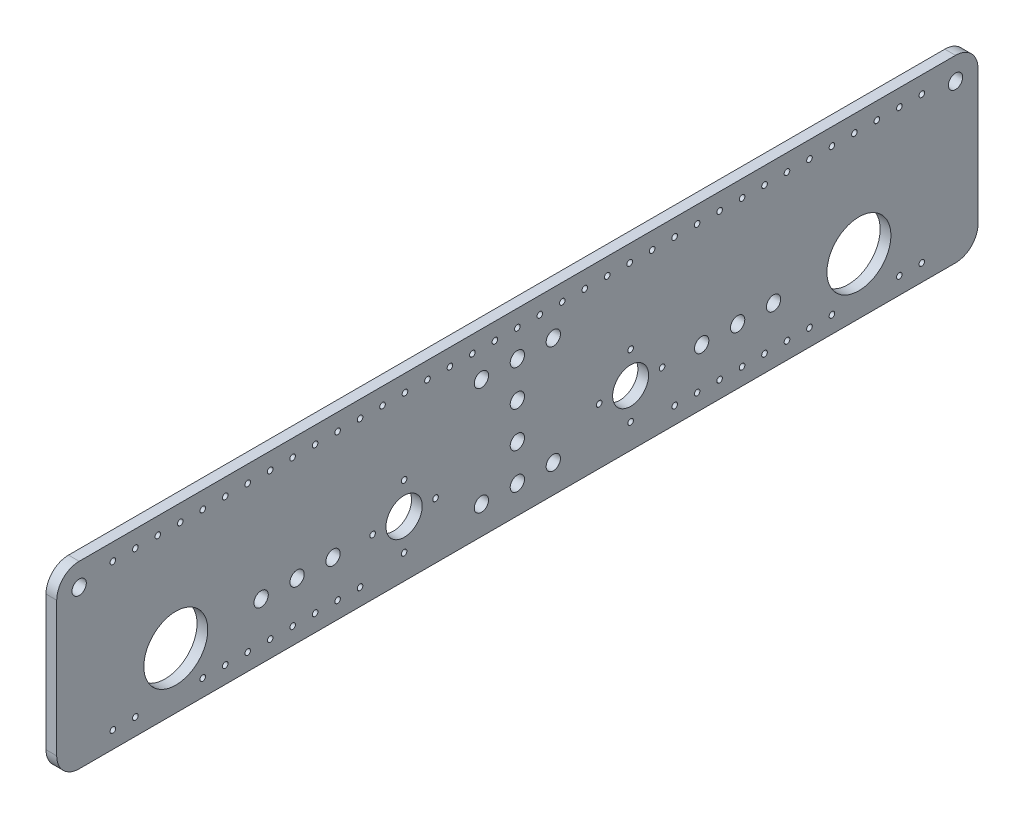
from build123d import *

# Parameters (mm, degrees)
SKETCH2_R           = 14.225
SKETCH2_R_2         = 3.18
SKETCH2_R_3         = 1.25
SKETCH2_R_4         = 8
SKETCH2_R_5         = 8.068284678
BOSS_EXTRUDE1_DEPTH = 4.7625


with BuildPart() as part:
    # Sketch2 → Boss-Extrude1 (new body)
    with BuildSketch(Plane(origin=(0, 0, 0), x_dir=(0, 0, -1), z_dir=(1, 0, 0))):
        with BuildLine():
            Line((-23.472321429, 28.668303571), (-23.472321429, -31.331696429))
            ThreePointArc((-23.472321429, -31.331696429), (-20.54338924, -38.40276424), (-13.472321429, -41.331696429))
            Line((-13.472321429, -41.331696429), (376.527678571, -41.331696429))
            ThreePointArc((376.527678571, -41.331696429), (383.598746383, -38.40276424), (386.527678571, -31.331696429))
            Line((386.527678571, -31.331696429), (386.527678571, 28.668303571))
            ThreePointArc((386.527678571, 28.668303571), (383.598746383, 35.739371383), (376.527678571, 38.668303571))
            Line((376.527678571, 38.668303571), (-13.472321429, 38.668303571))
            ThreePointArc((-13.472321429, 38.668303571), (-20.54338924, 35.739371383), (-23.472321429, 28.668303571))
        make_face()
        with Locations((29.527678571, -16.331696429)):
            Circle(SKETCH2_R, mode=Mode.SUBTRACT)
        with Locations((333.527678571, -16.331696429)):
            Circle(SKETCH2_R, mode=Mode.SUBTRACT)
        with Locations((181.527678571, -28.771696429)):
            Circle(SKETCH2_R_2, mode=Mode.SUBTRACT)
        with Locations((197.527678571, -28.771696429)):
            Circle(SKETCH2_R_2, mode=Mode.SUBTRACT)
        with Locations((197.527678571, 19.228303571)):
            Circle(SKETCH2_R_2, mode=Mode.SUBTRACT)
        with Locations((181.527678571, -12.771696429)):
            Circle(SKETCH2_R_2, mode=Mode.SUBTRACT)
        with Locations((181.527678571, 3.228303571)):
            Circle(SKETCH2_R_2, mode=Mode.SUBTRACT)
        with Locations((181.527678571, 19.228303571)):
            Circle(SKETCH2_R_2, mode=Mode.SUBTRACT)
        with Locations((165.527678571, -28.771696429)):
            Circle(SKETCH2_R_2, mode=Mode.SUBTRACT)
        with Locations((165.527678571, 19.228303571)):
            Circle(SKETCH2_R_2, mode=Mode.SUBTRACT)
        with Locations((83.502678571, -16.331696429)):
            Circle(SKETCH2_R_2, mode=Mode.SUBTRACT)
        with Locations((279.552678571, -16.331696429)):
            Circle(SKETCH2_R_2, mode=Mode.SUBTRACT)
        with Locations((1.527678571, 31.168303571)):
            Circle(SKETCH2_R_3, mode=Mode.SUBTRACT)
        with Locations((11.527678571, 31.168303571)):
            Circle(SKETCH2_R_3, mode=Mode.SUBTRACT)
        with Locations((21.527678571, 31.168303571)):
            Circle(SKETCH2_R_3, mode=Mode.SUBTRACT)
        with Locations((31.527678571, 31.168303571)):
            Circle(SKETCH2_R_3, mode=Mode.SUBTRACT)
        with Locations((41.527678571, 31.168303571)):
            Circle(SKETCH2_R_3, mode=Mode.SUBTRACT)
        with Locations((51.527678571, 31.168303571)):
            Circle(SKETCH2_R_3, mode=Mode.SUBTRACT)
        with Locations((61.527678571, 31.168303571)):
            Circle(SKETCH2_R_3, mode=Mode.SUBTRACT)
        with Locations((71.527678571, 31.168303571)):
            Circle(SKETCH2_R_3, mode=Mode.SUBTRACT)
        with Locations((81.527678571, 31.168303571)):
            Circle(SKETCH2_R_3, mode=Mode.SUBTRACT)
        with Locations((91.527678571, 31.168303571)):
            Circle(SKETCH2_R_3, mode=Mode.SUBTRACT)
        with Locations((101.527678571, 31.168303571)):
            Circle(SKETCH2_R_3, mode=Mode.SUBTRACT)
        with Locations((111.527678571, 31.168303571)):
            Circle(SKETCH2_R_3, mode=Mode.SUBTRACT)
        with Locations((121.527678571, 31.168303571)):
            Circle(SKETCH2_R_3, mode=Mode.SUBTRACT)
        with Locations((131.527678571, 31.168303571)):
            Circle(SKETCH2_R_3, mode=Mode.SUBTRACT)
        with Locations((141.527678571, 31.168303571)):
            Circle(SKETCH2_R_3, mode=Mode.SUBTRACT)
        with Locations((151.527678571, 31.168303571)):
            Circle(SKETCH2_R_3, mode=Mode.SUBTRACT)
        with Locations((161.527678571, 31.168303571)):
            Circle(SKETCH2_R_3, mode=Mode.SUBTRACT)
        with Locations((171.527678571, 31.168303571)):
            Circle(SKETCH2_R_3, mode=Mode.SUBTRACT)
        with Locations((181.527678571, 31.168303571)):
            Circle(SKETCH2_R_3, mode=Mode.SUBTRACT)
        with Locations((191.527678571, 31.168303571)):
            Circle(SKETCH2_R_3, mode=Mode.SUBTRACT)
        with Locations((201.527678571, 31.168303571)):
            Circle(SKETCH2_R_3, mode=Mode.SUBTRACT)
        with Locations((211.527678571, 31.168303571)):
            Circle(SKETCH2_R_3, mode=Mode.SUBTRACT)
        with Locations((221.527678571, 31.168303571)):
            Circle(SKETCH2_R_3, mode=Mode.SUBTRACT)
        with Locations((231.527678571, 31.168303571)):
            Circle(SKETCH2_R_3, mode=Mode.SUBTRACT)
        with Locations((241.527678571, 31.168303571)):
            Circle(SKETCH2_R_3, mode=Mode.SUBTRACT)
        with Locations((251.527678571, 31.168303571)):
            Circle(SKETCH2_R_3, mode=Mode.SUBTRACT)
        with Locations((261.527678571, 31.168303571)):
            Circle(SKETCH2_R_3, mode=Mode.SUBTRACT)
        with Locations((271.527678571, 31.168303571)):
            Circle(SKETCH2_R_3, mode=Mode.SUBTRACT)
        with Locations((281.527678571, 31.168303571)):
            Circle(SKETCH2_R_3, mode=Mode.SUBTRACT)
        with Locations((291.527678571, 31.168303571)):
            Circle(SKETCH2_R_3, mode=Mode.SUBTRACT)
        with Locations((301.527678571, 31.168303571)):
            Circle(SKETCH2_R_3, mode=Mode.SUBTRACT)
        with Locations((311.527678571, 31.168303571)):
            Circle(SKETCH2_R_3, mode=Mode.SUBTRACT)
        with Locations((321.527678571, 31.168303571)):
            Circle(SKETCH2_R_3, mode=Mode.SUBTRACT)
        with Locations((331.527678571, 31.168303571)):
            Circle(SKETCH2_R_3, mode=Mode.SUBTRACT)
        with Locations((341.527678571, 31.168303571)):
            Circle(SKETCH2_R_3, mode=Mode.SUBTRACT)
        with Locations((351.527678571, 31.168303571)):
            Circle(SKETCH2_R_3, mode=Mode.SUBTRACT)
        with Locations((361.527678571, 31.168303571)):
            Circle(SKETCH2_R_3, mode=Mode.SUBTRACT)
        with Locations((1.527678571, -33.831696429)):
            Circle(SKETCH2_R_3, mode=Mode.SUBTRACT)
        with Locations((11.527678571, -33.831696429)):
            Circle(SKETCH2_R_3, mode=Mode.SUBTRACT)
        with Locations((41.527678571, -33.831696429)):
            Circle(SKETCH2_R_3, mode=Mode.SUBTRACT)
        with Locations((51.527678571, -33.831696429)):
            Circle(SKETCH2_R_3, mode=Mode.SUBTRACT)
        with Locations((61.527678571, -33.831696429)):
            Circle(SKETCH2_R_3, mode=Mode.SUBTRACT)
        with Locations((71.527678571, -33.831696429)):
            Circle(SKETCH2_R_3, mode=Mode.SUBTRACT)
        with Locations((81.527678571, -33.831696429)):
            Circle(SKETCH2_R_3, mode=Mode.SUBTRACT)
        with Locations((91.527678571, -33.831696429)):
            Circle(SKETCH2_R_3, mode=Mode.SUBTRACT)
        with Locations((101.527678571, -33.831696429)):
            Circle(SKETCH2_R_3, mode=Mode.SUBTRACT)
        with Locations((111.527678571, -33.831696429)):
            Circle(SKETCH2_R_3, mode=Mode.SUBTRACT)
        with Locations((251.527678571, -33.831696429)):
            Circle(SKETCH2_R_3, mode=Mode.SUBTRACT)
        with Locations((261.527678571, -33.831696429)):
            Circle(SKETCH2_R_3, mode=Mode.SUBTRACT)
        with Locations((271.527678571, -33.831696429)):
            Circle(SKETCH2_R_3, mode=Mode.SUBTRACT)
        with Locations((281.527678571, -33.831696429)):
            Circle(SKETCH2_R_3, mode=Mode.SUBTRACT)
        with Locations((291.527678571, -33.831696429)):
            Circle(SKETCH2_R_3, mode=Mode.SUBTRACT)
        with Locations((301.527678571, -33.831696429)):
            Circle(SKETCH2_R_3, mode=Mode.SUBTRACT)
        with Locations((311.527678571, -33.831696429)):
            Circle(SKETCH2_R_3, mode=Mode.SUBTRACT)
        with Locations((321.527678571, -33.831696429)):
            Circle(SKETCH2_R_3, mode=Mode.SUBTRACT)
        with Locations((351.527678571, -33.831696429)):
            Circle(SKETCH2_R_3, mode=Mode.SUBTRACT)
        with Locations((361.527678571, -33.831696429)):
            Circle(SKETCH2_R_3, mode=Mode.SUBTRACT)
        with Locations((-13.472321429, 28.668303571)):
            Circle(SKETCH2_R_2, mode=Mode.SUBTRACT)
        with Locations((376.527678571, 28.668303571)):
            Circle(SKETCH2_R_2, mode=Mode.SUBTRACT)
        with Locations((99.502678571, -16.331696429)):
            Circle(SKETCH2_R_2, mode=Mode.SUBTRACT)
        with Locations((295.552678571, -16.331696429)):
            Circle(SKETCH2_R_2, mode=Mode.SUBTRACT)
        with Locations((67.502678571, -16.331696429)):
            Circle(SKETCH2_R_2, mode=Mode.SUBTRACT)
        with Locations((263.552678571, -16.331696429)):
            Circle(SKETCH2_R_2, mode=Mode.SUBTRACT)
        with Locations((131.127678571, -30.331696429)):
            Circle(SKETCH2_R_3, mode=Mode.SUBTRACT)
        with Locations((145.127678571, -16.331696429)):
            Circle(SKETCH2_R_3, mode=Mode.SUBTRACT)
        with Locations((131.127678571, -2.331696429)):
            Circle(SKETCH2_R_3, mode=Mode.SUBTRACT)
        with Locations((117.127678571, -16.331696429)):
            Circle(SKETCH2_R_3, mode=Mode.SUBTRACT)
        with Locations((231.927678571, -30.331696429)):
            Circle(SKETCH2_R_3, mode=Mode.SUBTRACT)
        with Locations((217.927678571, -16.331696429)):
            Circle(SKETCH2_R_3, mode=Mode.SUBTRACT)
        with Locations((231.927678571, -2.331696429)):
            Circle(SKETCH2_R_3, mode=Mode.SUBTRACT)
        with Locations((245.927678571, -16.331696429)):
            Circle(SKETCH2_R_3, mode=Mode.SUBTRACT)
        with Locations((231.927678571, -16.331696429)):
            Circle(SKETCH2_R_4, mode=Mode.SUBTRACT)
        with Locations((131.127678571, -16.331696429)):
            Circle(SKETCH2_R_5, mode=Mode.SUBTRACT)
    extrude(amount=BOSS_EXTRUDE1_DEPTH)


solid = part.part
